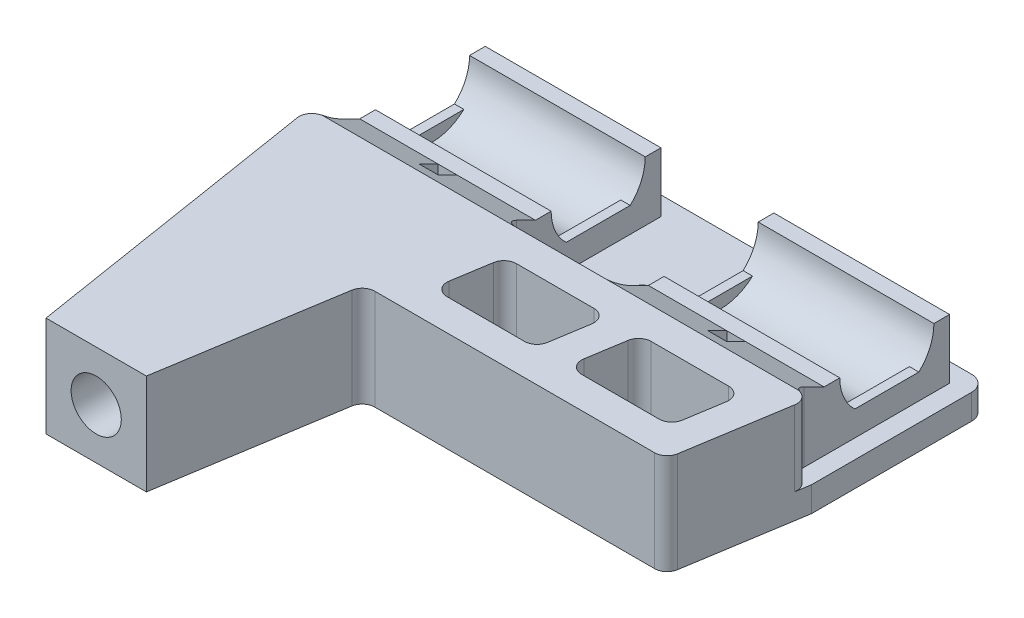
from build123d import *
from build123d.topology import SkipClean

# Parameters (mm, degrees)
SKETCH7_W       = 80
SKETCH7_H       = 28
EXTRUDE2_DEPTH  = 4
SKETCH8_W       = 28
SKETCH8_H       = 20
EXTRUDE3_DEPTH  = 9.5
EXTRUDE6_DEPTH  = 28
SKETCH15_R      = 7.5
EXTRUDE7_DEPTH  = 25
SKETCH16_W      = 3
SKETCH16_H      = 3
SKETCH8_4_W     = 28
SKETCH8_4_H     = 20
EXTRUDE8_DEPTH  = 9.5
EXTRUDE9_DEPTH  = 28
SKETCH19_R      = 7.5
EXTRUDE10_DEPTH = 25
SKETCH20_W      = 3
SKETCH20_H      = 3
FILLET1_R       = 2.5
EXTRUDE11_DEPTH = 16
SKETCH25_W      = 28
SKETCH25_H      = 5
EXTRUDE13_DEPTH = 12
EXTRUDE14_REACH = 90.69
FILLET11_R      = 2
SKETCH27_W      = 28
SKETCH27_H      = 5
EXTRUDE15_DEPTH = 12
EXTRUDE16_REACH = 90.69
FILLET14_R      = 2
SKETCH30_W      = 3
SKETCH30_H      = 3
EXTRUDE17_DEPTH = 12
SKETCH31_W      = 3
SKETCH31_H      = 3
EXTRUDE18_DEPTH = 12
SKETCH32_R      = 4
EXTRUDE19_DEPTH = 40
FILLET15_R      = 2
FILLET16_R      = 2
FILLET17_R      = 2
FILLET18_R      = 2
FILLET19_R      = 2
FILLET20_R      = 2
FILLET21_R      = 2
SKETCH33_R      = 1.5
EXTRUDE20_DEPTH = 59.523499692


with BuildPart() as part:
    # Sketch7 → Extrude2 (new body)
    with BuildSketch(Plane(origin=(0, 0, 0), x_dir=(1, 0, 0), z_dir=(0, 1, 0))):
        with Locations((0, 23)):
            Rectangle(SKETCH7_W, SKETCH7_H)
    extrude(amount=EXTRUDE2_DEPTH)


with BuildPart() as body_2:
    # Sketch8 → Extrude3 (new body)
    with BuildSketch(Plane(origin=(0, 4, 0), x_dir=(1, 0, 0), z_dir=(0, 1, 0))):
        with Locations((-23, 24)):
            Rectangle(SKETCH8_W, SKETCH8_H)
    extrude(amount=EXTRUDE3_DEPTH)

    # Sketch10 → Extrude6 (cut)
    with BuildSketch(Plane(origin=(-9, 0, 0), x_dir=(0, 0, -1), z_dir=(1, 0, 0))):
        with BuildLine():
            Line((31.5, 13.5), (24, 13.5))
            Line((24, 13.5), (16.5, 13.5))
            ThreePointArc((16.5, 13.5), (17.126403912, 10.499387259), (18.900980486, 8))
            Line((18.900980486, 8), (29.099019514, 8))
            ThreePointArc((29.099019514, 8), (30.873596088, 10.499387259), (31.5, 13.5))
        make_face()
    extrude(amount=-EXTRUDE6_DEPTH, mode=Mode.SUBTRACT)

    # Sketch15 → Extrude7 (cut)
    with SkipClean():  # the faces are left unmerged after this step: merging them gives an invalid solid
        with BuildSketch(Plane.ZY.offset(35.5)):
            with Locations((-24, 13.5)):
                Circle(SKETCH15_R)
        extrude(amount=-EXTRUDE7_DEPTH, mode=Mode.SUBTRACT)


with BuildPart() as cut_sweep1_tool:
    # Cut-Sweep1: sweep along a path in Sketch17
    with SkipClean():  # the faces are left unmerged after this step: merging them gives an invalid solid
        with BuildLine(Plane(origin=(-23, 0, 0), x_dir=(0, 0, -1), z_dir=(1, 0, 0))) as cut_sweep1_path:
            CenterArc((24, 13.5), 12.806248475, 0, 360)
        # Sketch16 → Cut-Sweep1 (sweep)
        with BuildSketch(Plane.XY.offset(-14)):
            with Locations((-23, 5.5)):
                Rectangle(SKETCH16_W, SKETCH16_H)
        sweep(path=cut_sweep1_path.line)


with BuildPart() as part_1:
    with SkipClean():  # the faces are left unmerged after this step: merging them gives an invalid solid
        add(part.part)

        # Cut-Sweep1: cut by cut_sweep1_tool
        add(cut_sweep1_tool.part, mode=Mode.SUBTRACT)

    # Sketch8<4> → Extrude8 (add)
    with BuildSketch(Plane(origin=(0, 4, 0), x_dir=(1, 0, 0), z_dir=(0, 1, 0))):
        with Locations((23, 24)):
            Rectangle(SKETCH8_4_W, SKETCH8_4_H)
    extrude(amount=EXTRUDE8_DEPTH)

    # Sketch18 → Extrude9 (cut)
    with BuildSketch(Plane(origin=(37, 0, 0), x_dir=(0, 0, -1), z_dir=(1, 0, 0))):
        with BuildLine():
            Line((18.900980486, 8), (29.099019514, 8))
            ThreePointArc((29.099019514, 8), (30.873596088, 10.499387259), (31.5, 13.5))
            Line((31.5, 13.5), (16.5, 13.5))
            ThreePointArc((16.5, 13.5), (17.126403912, 10.499387259), (18.900980486, 8))
        make_face()
    extrude(amount=-EXTRUDE9_DEPTH, mode=Mode.SUBTRACT)

    # Sketch19 → Extrude10 (cut)
    with BuildSketch(Plane(origin=(35.5, 0, 0), x_dir=(0, 0, -1), z_dir=(1, 0, 0))):
        with Locations((24, 13.5)):
            Circle(SKETCH19_R)
    extrude(amount=-EXTRUDE10_DEPTH, mode=Mode.SUBTRACT)

    # Cut-Sweep2: sweep along a path in Sketch21
    with BuildLine(Plane(origin=(23, 0, 0), x_dir=(0, 0, -1), z_dir=(1, 0, 0))) as cut_sweep2_path:
        CenterArc((24, 13.5), 12.806248475, 0, 360)
    # Sketch20 → Cut-Sweep2 (sweep, cut)
    with BuildSketch(Plane.XY.offset(-14)):
        with Locations((23, 5.5)):
            Rectangle(SKETCH20_W, SKETCH20_H)
    sweep(path=cut_sweep2_path.line, mode=Mode.SUBTRACT)

    # Fillet1
    fillet1_edges = [part_1.edges().sort_by_distance(p)[0] for p in [
        (-40, 2, -37),
        (40, 2, -37),
    ]]
    fillet(fillet1_edges, radius=FILLET1_R)

    # Sketch22 → Extrude11 (add)
    with BuildSketch(Plane(origin=(0, 0, 0), x_dir=(1, 0, 0), z_dir=(0, 1, 0))):
        Polygon((36.784969303, -11.093941854), (40, 9), (-40, 9), (-32, -41), (-16, -41), (-11.215030697, -11.093941854), align=None)
        Polygon((12.66820222, 4), (11.053171523, -6.093941854), (-5.351435136, -6.093941854), (-3.73640444, 4), align=None, mode=Mode.SUBTRACT)
        Polygon((17.73179778, 4), (34.13640444, 4), (32.521373743, -6.093941854), (16.116767084, -6.093941854), align=None, mode=Mode.SUBTRACT)
    extrude(amount=EXTRUDE11_DEPTH)



with BuildPart() as body_2_1:
    with SkipClean():  # the faces are left unmerged after this step: merging them gives an invalid solid
        add(body_2.part)

        # Cut-Sweep1: cut by cut_sweep1_tool
        add(cut_sweep1_tool.part, mode=Mode.SUBTRACT)


with BuildPart() as part_2:
    with SkipClean():  # the faces are left unmerged after this step: merging them gives an invalid solid
        add(part_1.part)

        add(body_2_1.part)  # Extrude13 merges body 2
        # Sketch25 → Extrude13 (add)
        with BuildSketch(Plane(origin=(0, 4, 0), x_dir=(-1, 0, 0), z_dir=(0, 1, 0))):
            with Locations((23, -11.5)):
                Rectangle(SKETCH25_W, SKETCH25_H)
        extrude(amount=EXTRUDE13_DEPTH)

    # Sketch26 → Extrude14 (cut, up to next)
    with BuildSketch(Plane.ZY.offset(37), mode=Mode.PRIVATE) as extrude14_sk1:
        Polygon((-14, 13.5), (-9, 16), (-14, 16), align=None)
    extrude14_tool1 = extrude(extrude14_sk1.sketch, amount=-EXTRUDE14_REACH, mode=Mode.PRIVATE) & part_2.part
    add(extrude14_tool1.solids().sort_by_distance((-37, 15.166667, -12.333333))[0], mode=Mode.SUBTRACT)

    # Fillet11
    fillet11_edges = [part_2.edges().sort_by_distance(p)[0] for p in [
        (-9, 10, -9),
    ]]
    fillet(fillet11_edges, radius=FILLET11_R)

    # Sketch27 → Extrude15 (add)
    with SkipClean():  # the faces are left unmerged after this step: merging them gives an invalid solid
        with BuildSketch(Plane(origin=(0, 4, 0), x_dir=(-1, 0, 0), z_dir=(0, 1, 0))):
            with Locations((-23, -11.5)):
                Rectangle(SKETCH27_W, SKETCH27_H)
        extrude(amount=EXTRUDE15_DEPTH)

    # Sketch28 → Extrude16 (cut, up to next)
    with BuildSketch(Plane(origin=(37, 0, 0), x_dir=(0, 0, -1), z_dir=(1, 0, 0)), mode=Mode.PRIVATE) as extrude16_sk1:
        Polygon((14, 13.5), (9, 16), (14, 16), align=None)
    extrude16_tool1 = extrude(extrude16_sk1.sketch, amount=-EXTRUDE16_REACH, mode=Mode.PRIVATE) & part_2.part
    add(extrude16_tool1.solids().sort_by_distance((37, 15.166667, -12.333333))[0], mode=Mode.SUBTRACT)

    # Fillet14
    fillet14_edges = [part_2.edges().sort_by_distance(p)[0] for p in [
        (9, 10, -9),
    ]]
    fillet(fillet14_edges, radius=FILLET14_R)

    # Sketch30 → Extrude17 (cut)
    with SkipClean():  # the faces are left unmerged after this step: merging them gives an invalid solid
        with BuildSketch(Plane(origin=(0, 16, 0), x_dir=(-1, 0, 0), z_dir=(0, 1, 0))):
            with Locations((-23, -12.5)):
                Rectangle(SKETCH30_W, SKETCH30_H)
        extrude(amount=-EXTRUDE17_DEPTH, mode=Mode.SUBTRACT)

    # Sketch31 → Extrude18 (cut)
    with SkipClean():  # the faces are left unmerged after this step: merging them gives an invalid solid
        with BuildSketch(Plane(origin=(0, 16, 0), x_dir=(-1, 0, 0), z_dir=(0, 1, 0))):
            with Locations((23, -12.5)):
                Rectangle(SKETCH31_W, SKETCH31_H)
        extrude(amount=-EXTRUDE18_DEPTH, mode=Mode.SUBTRACT)

    # Sketch32 → Extrude19 (cut)
    with SkipClean():  # the faces are left unmerged after this step: merging them gives an invalid solid
        with BuildSketch(Plane.XY.offset(41)):
            with Locations((-24, 8)):
                Circle(SKETCH32_R)
        extrude(amount=-EXTRUDE19_DEPTH, mode=Mode.SUBTRACT)

    # Fillet15
    fillet15_edges = [part_2.edges().sort_by_distance(p)[0] for p in [
        (-40, 10, -9),
    ]]
    fillet(fillet15_edges, radius=FILLET15_R)

    # Fillet16
    # the kernel refuses this fillet: 2 mm, written as the material it adds along each edge
    with BuildSketch(Plane(origin=(-37, -0.417336402, -9), x_dir=(0, 0, -1), z_dir=(0, 1, 0))) as fillet16_piece_1_section:
        with BuildLine():
            CenterArc((1.766934561, 2), FILLET16_R, 199.655233066, 70.344766934)
            Line((-0.11653272, 1.327280888), (-0.304879448, 1.260008977))
            ThreePointArc((-0.304879448, 1.260008977), (-0.2, 0.654561776), (-0.2, 0))
            Line((-0.2, 0), (0, -0.2))
            Line((0, -0.2), (1.766934561, -0.2))
            Line((1.766934561, -0.2), (1.766934561, 0))
        make_face()
    fillet16_piece_1 = extrude(amount=16.417336402, mode=Mode.PRIVATE)
    fillet16_piece_1 = split(fillet16_piece_1, bisect_by=Plane(origin=(-37.361885023, 0, -9.612553635), z_dir=(0, 1, 0)), keep=Keep.TOP, mode=Mode.PRIVATE)
    fillet16_piece_1 = split(fillet16_piece_1, bisect_by=Plane(origin=(-37.361885023, 14.554978546, -11.890042908), z_dir=(0, -0.8944271909999159, 0.44721359549995804)), keep=Keep.TOP, mode=Mode.PRIVATE)
    add(fillet16_piece_1)

    # Fillet17
    fillet17_edges = [part_2.edges().sort_by_distance(p)[0] for p in [
        (40, 10, -9),
    ]]
    fillet(fillet17_edges, radius=FILLET17_R)

    # Fillet18
    # the kernel refuses this fillet: 2 mm, written as the material it adds along each edge
    with BuildSketch(Plane(origin=(37, -0.417336402, -9), x_dir=(0.9961678888786428, 0, 0.08746163254289245), z_dir=(0, 1, 0))) as fillet18_piece_1_section:
        with BuildLine():
            CenterArc((1.837796796, 1.935086736), FILLET18_R, 185.017593378, 70.344766934)
            Line((-0.154538981, 1.760163471), (-0.353772559, 1.742671145))
            Line((-0.353772559, 1.742671145), (-0.199233578, -0.017492327))
            Line((-0.199233578, -0.017492327), (0.017492327, -0.199233578))
            ThreePointArc((0.017492327, -0.199233578), (0.669545749, -0.141984536), (1.281845737, -0.193508674))
            Line((1.281845737, -0.193508674), (1.332386742, 0))
        make_face()
    fillet18_piece_1 = extrude(amount=16.417336402, mode=Mode.PRIVATE)
    fillet18_piece_1 = split(fillet18_piece_1, bisect_by=Plane(origin=(37.361885023, 14.554978546, -11.890042908), z_dir=(0, -0.8944271909999157, 0.4472135954999582)), keep=Keep.TOP, mode=Mode.PRIVATE)
    fillet18_piece_1 = split(fillet18_piece_1, bisect_by=Plane(origin=(37.361885023, 0, -9.612553635), z_dir=(0, 1, 0)), keep=Keep.TOP, mode=Mode.PRIVATE)
    add(fillet18_piece_1)

    # Fillet19
    fillet19_edges = [part_2.edges().sort_by_distance(p)[0] for p in [
        (11.053171523, 8, 6.093941854),
        (32.521373743, 8, 6.093941854),
    ]]
    fillet(fillet19_edges, radius=FILLET19_R)

    # Fillet20
    fillet20_edges = [part_2.edges().sort_by_distance(p)[0] for p in [
        (36.784969303, 8, 11.093941854),
        (-3.73640444, 8, -4),
        (-5.351435136, 8, 6.093941854),
        (12.66820222, 8, -4),
        (34.13640444, 8, -4),
        (17.73179778, 8, -4),
        (16.116767084, 8, 6.093941854),
    ]]
    fillet(fillet20_edges, radius=FILLET20_R)

    # Fillet21
    fillet21_edges = [part_2.edges().sort_by_distance(p)[0] for p in [
        (-11.215030697, 8, 11.093941854),
    ]]
    fillet(fillet21_edges, radius=FILLET21_R)

    # Sketch33 → Extrude20 (cut, through all)
    with BuildSketch(Plane(origin=(0, 4, 0), x_dir=(-1, 0, 0), z_dir=(0, 1, 0))):
        with Locations(Location((0, -13.5, 0), (0, 0, 90))):
            Circle(SKETCH33_R)
        with Locations(Location((0, -22, 0), (0, 0, 90))):
            Circle(SKETCH33_R)
    extrude(amount=-EXTRUDE20_DEPTH, mode=Mode.SUBTRACT)


solid = part_2.part
